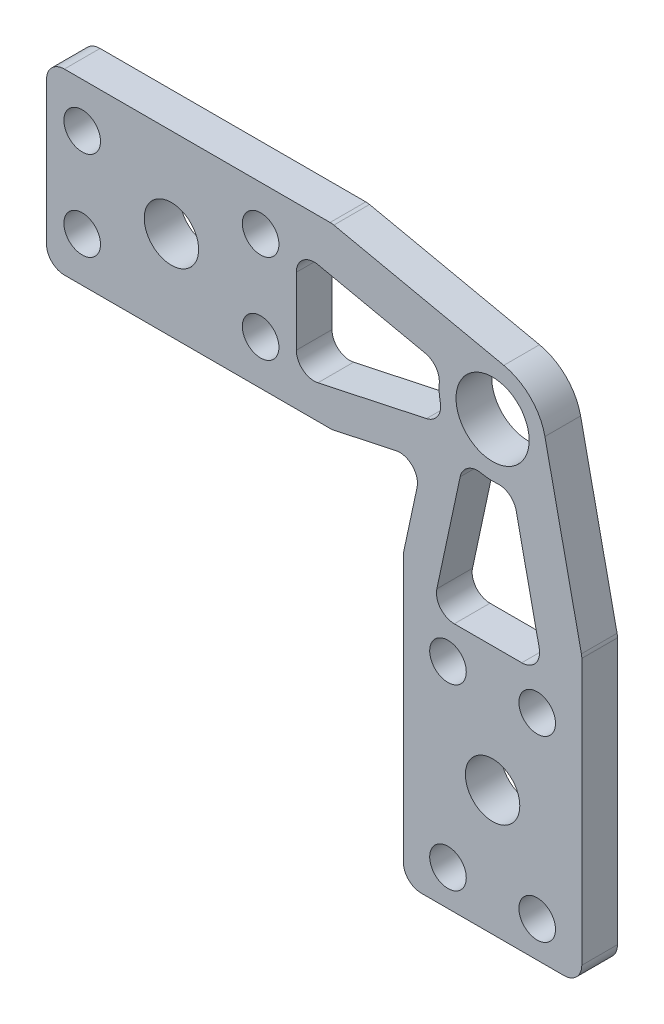
from build123d import *

# Parameters (mm, degrees)
EXTRUDE_1_DEPTH         = 3
SKETCH_2_R              = 2.05
CUT_EXTRUDE_1_DEPTH     = 10
CUT_EXTRUDE_2_DEPTH     = 10
SKETCH_4_R              = 4.1
CUT_EXTRUDE_3_DEPTH     = 10
SKETCH_5_W              = 14
SKETCH_5_H              = 10
SKETCH_5_W_2            = 10
SKETCH_5_H_2            = 14
CUT_EXTRUDE_4_DEPTH     = 10
FILLET_1_R              = 2
FILLET_2_R              = 2
MOVE_START              = 3
MOVE_FACE_1_OUTLINE_R   = 2.05
MOVE_FACE_1_OUTLINE_R_2 = 4.1
MOVE_FACE_1_DEPTH       = 1
SKETCH_9_W              = 14
SKETCH_9_H              = 10
SKETCH_9_W_2            = 10
SKETCH_9_H_2            = 14
EXTRUDE_2_DEPTH         = 4
SKETCH_10_R             = 3.05
CUT_EXTRUDE_6_DEPTH     = 10


# Read off the part's stored shape, not the designer's step: 移动面1
with BuildPart() as part:
    # 草图1 → 凸台-拉伸1 (new body)
    with BuildSketch(Plane.XY):
        Polygon((-50, 10), (10, 10), (10, -50), (-10, -50), (-10, -10), (-50, -10), align=None)
    extrude(amount=EXTRUDE_1_DEPTH)

    # 草图2 → 切除-拉伸1 (cut)
    with BuildSketch(Plane.XY.offset(3)):
        with Locations((-26, -5)):
            Circle(SKETCH_2_R)
        with Locations((-46, 5)):
            Circle(SKETCH_2_R)
        with Locations((-46, -5)):
            Circle(SKETCH_2_R)
        with Locations((-26, 5)):
            Circle(SKETCH_2_R)
        with Locations((5, -26)):
            Circle(SKETCH_2_R)
        with Locations((-5, -46)):
            Circle(SKETCH_2_R)
        with Locations((5, -46)):
            Circle(SKETCH_2_R)
        with Locations((-5, -26)):
            Circle(SKETCH_2_R)
    extrude(amount=-CUT_EXTRUDE_1_DEPTH, mode=Mode.SUBTRACT)

    # 草图3 → 切除-拉伸2 (cut)
    with BuildSketch(Plane.XY.offset(3)):
        with BuildLine():
            Line((-18, 10), (1.259110699, 5.866399258))
            ThreePointArc((1.259110699, 5.866399258), (4.242640687, 4.242640687), (5.866399258, 1.259110699))
            Line((5.866399258, 1.259110699), (10, -18))
            Line((10, -18), (10, 10))
            Line((10, 10), (-18, 10))
        make_face()
        Polygon((-18, -10), (-7.813706378, -7.813706378), (-10, -18), align=None)
    extrude(amount=-CUT_EXTRUDE_2_DEPTH, mode=Mode.SUBTRACT)

    # 草图4 → 切除-拉伸3 (cut)
    with BuildSketch(Plane.XY.offset(3)):
        Circle(SKETCH_4_R)
    extrude(amount=-CUT_EXTRUDE_3_DEPTH, mode=Mode.SUBTRACT)

    # 草图5 → 切除-拉伸4 (cut)
    with BuildSketch(Plane.XY.offset(3)):
        with Locations((-36, 0)):
            Rectangle(SKETCH_5_W, SKETCH_5_H)
        with BuildLine():
            Line((-22, 5.74465424), (-22, -6.767428132))
            Line((-22, -6.767428132), (-5.111190695, -3.14256737))
            ThreePointArc((-5.111190695, -3.14256737), (-5.977725364, -0.516526349), (-5.574495891, 2.219233101))
            Line((-5.574495891, 2.219233101), (-22, 5.74465424))
        make_face()
        with BuildLine():
            Line((2.219233101, -5.574495891), (5.74465424, -22))
            Line((5.74465424, -22), (-6.767428132, -22))
            Line((-6.767428132, -22), (-3.14256737, -5.111190695))
            ThreePointArc((-3.14256737, -5.111190695), (-0.516526349, -5.977725364), (2.219233101, -5.574495891))
        make_face()
        with Locations((0, -36)):
            Rectangle(SKETCH_5_W_2, SKETCH_5_H_2)
    extrude(amount=-CUT_EXTRUDE_4_DEPTH, mode=Mode.SUBTRACT)

    # 圆角1
    fillet_1_edges = [part.edges().sort_by_distance(p)[0] for p in [
        (-29, 5, 1.5),
        (-29, -5, 1.5),
        (-43, -5, 1.5),
        (-43, 5, 1.5),
        (-3.14256737, -5.111190695, 1.5),
        (2.219233101, -5.574495891, 1.5),
        (5.74465424, -22, 1.5),
        (-6.767428132, -22, 1.5),
        (5, -43, 1.5),
        (-5, -43, 1.5),
        (-5, -29, 1.5),
        (5, -29, 1.5),
        (-22, 5.74465424, 1.5),
        (-5.574495891, 2.219233101, 1.5),
        (-5.111190695, -3.14256737, 1.5),
        (-22, -6.767428132, 1.5),
    ]]
    fillet(fillet_1_edges, radius=FILLET_1_R)

    # 圆角2
    fillet_2_edges = [part.edges().sort_by_distance(p)[0] for p in [
        (-50, 10, 1.5),
        (10, -50, 1.5),
        (-10, -50, 1.5),
        (-50, -10, 1.5),
        (-18, -10, 1.5),
        (-7.813706378, -7.813706378, 1.5),
        (-10, -18, 1.5),
        (-18, 10, 1.5),
        (10, -18, 1.5),
    ]]
    fillet(fillet_2_edges, radius=FILLET_2_R)

    # Move Face 1 outline → Move Face 1 (add)
    with BuildSketch(Plane.XY.offset(MOVE_START)):
        with BuildLine():
            Line((-50, 8), (-50, -8))
            ThreePointArc((-50, -8), (-49.414213562, -9.414213562), (-48, -10))
            Line((-48, -10), (-18.21221445, -10))
            ThreePointArc((-18.21221445, -10), (-18.00118464, -9.988835443), (-17.792510884, -9.955466419))
            Line((-17.792510884, -9.955466419), (-10.837978737, -8.462808752))
            ThreePointArc((-10.837978737, -8.462808752), (-9.004061609, -9.004061609), (-8.462808752, -10.837978737))
            Line((-8.462808752, -10.837978737), (-9.955466419, -17.792510884))
            ThreePointArc((-9.955466419, -17.792510884), (-9.988835443, -18.00118464), (-10, -18.21221445))
            Line((-10, -18.21221445), (-10, -48))
            ThreePointArc((-10, -48), (-9.414213562, -49.414213562), (-8, -50))
            Line((-8, -50), (8, -50))
            ThreePointArc((8, -50), (9.414213562, -49.414213562), (10, -48))
            Line((10, -48), (10, -18.21221445))
            ThreePointArc((10, -18.21221445), (9.988835443, -18.00118464), (9.955466419, -17.792510884))
            Line((9.955466419, -17.792510884), (5.866399258, 1.259110699))
            ThreePointArc((5.866399258, 1.259110699), (4.242640687, 4.242640687), (1.259110699, 5.866399258))
            Line((1.259110699, 5.866399258), (-17.792510884, 9.955466419))
            ThreePointArc((-17.792510884, 9.955466419), (-18.00118464, 9.988835443), (-18.21221445, 10))
            Line((-18.21221445, 10), (-48, 10))
            ThreePointArc((-48, 10), (-49.414213562, 9.414213562), (-50, 8))
        make_face()
        with Locations((-5, -46)):
            Circle(MOVE_FACE_1_OUTLINE_R, mode=Mode.SUBTRACT)
        with Locations((5, -46)):
            Circle(MOVE_FACE_1_OUTLINE_R, mode=Mode.SUBTRACT)
        with BuildLine():
            Line((3, -43), (-3, -43))
            ThreePointArc((-3, -43), (-4.414213562, -42.414213562), (-5, -41))
            Line((-5, -41), (-5, -31))
            ThreePointArc((-5, -31), (-4.414213562, -29.585786438), (-3, -29))
            Line((-3, -29), (3, -29))
            ThreePointArc((3, -29), (4.414213562, -29.585786438), (5, -31))
            Line((5, -31), (5, -41))
            ThreePointArc((5, -41), (4.414213562, -42.414213562), (3, -43))
        make_face(mode=Mode.SUBTRACT)
        with Locations((-5, -26)):
            Circle(MOVE_FACE_1_OUTLINE_R, mode=Mode.SUBTRACT)
        with Locations((5, -26)):
            Circle(MOVE_FACE_1_OUTLINE_R, mode=Mode.SUBTRACT)
        with Locations((-46, -5)):
            Circle(MOVE_FACE_1_OUTLINE_R, mode=Mode.SUBTRACT)
        with BuildLine():
            Line((-29, 3), (-29, -3))
            ThreePointArc((-29, -3), (-29.585786438, -4.414213562), (-31, -5))
            Line((-31, -5), (-41, -5))
            ThreePointArc((-41, -5), (-42.414213562, -4.414213562), (-43, -3))
            Line((-43, -3), (-43, 3))
            ThreePointArc((-43, 3), (-42.414213562, 4.414213562), (-41, 5))
            Line((-41, 5), (-31, 5))
            ThreePointArc((-31, 5), (-29.585786438, 4.414213562), (-29, 3))
        make_face(mode=Mode.SUBTRACT)
        with Locations((-46, 5)):
            Circle(MOVE_FACE_1_OUTLINE_R, mode=Mode.SUBTRACT)
        with Locations((-26, -5)):
            Circle(MOVE_FACE_1_OUTLINE_R, mode=Mode.SUBTRACT)
        with Locations((-26, 5)):
            Circle(MOVE_FACE_1_OUTLINE_R, mode=Mode.SUBTRACT)
        with BuildLine():
            ThreePointArc((-3.634280684, -7.40216211), (-2.764762592, -6.142366874), (-1.259110699, -5.866399258))
            ThreePointArc((-1.259110699, -5.866399258), (-0.375737475, -5.988223555), (0.515935261, -5.97777641))
            ThreePointArc((0.515935261, -5.97777641), (1.87690568, -6.362171411), (2.6433801, -7.55066498))
            Line((2.6433801, -7.55066498), (5.225311026, -19.580296434))
            ThreePointArc((5.225311026, -19.580296434), (4.825384245, -21.257098418), (3.269844607, -22))
            Line((3.269844607, -22), (-4.292618499, -22))
            ThreePointArc((-4.292618499, -22), (-5.848158137, -21.257098418), (-6.248084918, -19.580296434))
            Line((-6.248084918, -19.580296434), (-3.634280684, -7.40216211))
        make_face(mode=Mode.SUBTRACT)
        with BuildLine():
            ThreePointArc((-7.55066498, 2.6433801), (-6.362171411, 1.87690568), (-5.97777641, 0.515935261))
            ThreePointArc((-5.97777641, 0.515935261), (-5.988223555, -0.375737475), (-5.866399258, -1.259110699))
            ThreePointArc((-5.866399258, -1.259110699), (-6.142366874, -2.764762592), (-7.40216211, -3.634280684))
            Line((-7.40216211, -3.634280684), (-19.580296434, -6.248084918))
            ThreePointArc((-19.580296434, -6.248084918), (-21.257098418, -5.848158137), (-22, -4.292618499))
            Line((-22, -4.292618499), (-22, 3.269844607))
            ThreePointArc((-22, 3.269844607), (-21.257098418, 4.825384245), (-19.580296434, 5.225311026))
            Line((-19.580296434, 5.225311026), (-7.55066498, 2.6433801))
        make_face(mode=Mode.SUBTRACT)
        Circle(MOVE_FACE_1_OUTLINE_R_2, mode=Mode.SUBTRACT)
    extrude(amount=MOVE_FACE_1_DEPTH)

    # 草图9 → 凸台-拉伸2 (add)
    with BuildSketch(Plane.XY.offset(4)):
        with Locations((-36, 0)):
            Rectangle(SKETCH_9_W, SKETCH_9_H)
        with Locations((0, -36)):
            Rectangle(SKETCH_9_W_2, SKETCH_9_H_2)
    extrude(amount=-EXTRUDE_2_DEPTH)

    # 草图10 → 切除-拉伸6 (cut)
    with BuildSketch(Plane.XY.offset(4)):
        with Locations((-36, 0)):
            Circle(SKETCH_10_R)
        with Locations((0, -36)):
            Circle(SKETCH_10_R)
    extrude(amount=-CUT_EXTRUDE_6_DEPTH, mode=Mode.SUBTRACT)


solid = part.part
